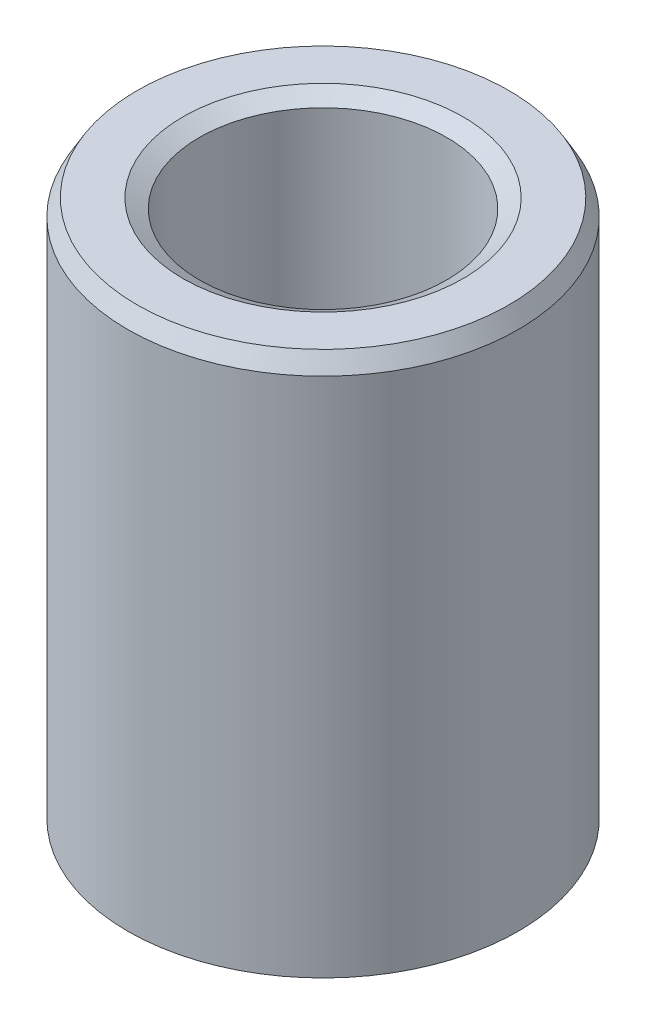
from build123d import *
from OCP.BRepFilletAPI import BRepFilletAPI_MakeChamfer

# Parameters (mm, degrees)
SKETCH1_R           = 25
BOSS_EXTRUDE1_DEPTH = 70.03656948
SKETCH2_R           = 15.821900765
CUT_EXTRUDE1_DEPTH  = 79.454579628
CHAMFER1_SIZE       = 2.111979683
CHAMFER1_SIZE2      = 1.219352039


with BuildPart() as part:
    # Sketch1 → Boss-Extrude1 (new body)
    with BuildSketch(Plane(origin=(0, 0, 0), x_dir=(1, 0, 0), z_dir=(0, 1, 0))):
        Circle(SKETCH1_R)
    extrude(amount=BOSS_EXTRUDE1_DEPTH)

    # Sketch2 → Cut-Extrude1 (cut, through all)
    with BuildSketch(Plane(origin=(0, 0, 0), x_dir=(1, 0, 0), z_dir=(0, 1, 0))):
        Circle(SKETCH2_R)
    extrude(amount=CUT_EXTRUDE1_DEPTH, mode=Mode.SUBTRACT)

    # Chamfer1: one chamfer whose edges measure the first distance from different faces: ONE call of the kernel's chamfer builder (chamfer() names one face for all edges)
    chamfer1_edges_1 = [part.edges().sort_by_distance(p)[0] for p in [
        (-15.821900765, 70.03656948, 0),
    ]]
    chamfer1_side_1 = [part.faces().sort_by_distance(p)[0] for p in [
        (-24.292893219, 70.03656948, 0),
    ]]
    chamfer1_edges_2 = [part.edges().sort_by_distance(p)[0] for p in [
        (-15.821900765, 0, 0),
    ]]
    chamfer1_side_2 = [part.faces().sort_by_distance(p)[0] for p in [
        (-15.821900765, 35.01828474, 0),
    ]]
    chamfer1_edges_3 = [part.edges().sort_by_distance(p)[0] for p in [
        (-25, 0, 0),
    ]]
    chamfer1_side_3 = [part.faces().sort_by_distance(p)[0] for p in [
        (-24.292893219, 0, 0),
    ]]
    chamfer1_edges_4 = [part.edges().sort_by_distance(p)[0] for p in [
        (-25, 70.03656948, 0),
    ]]
    chamfer1_side_4 = [part.faces().sort_by_distance(p)[0] for p in [
        (-25, 35.01828474, 0),
    ]]
    chamfer1 = BRepFilletAPI_MakeChamfer(part.part.solid().wrapped)
    for e in chamfer1_edges_1:
        chamfer1.Add(CHAMFER1_SIZE, CHAMFER1_SIZE2, e.wrapped, chamfer1_side_1[0].wrapped)  # the first distance lies on this face
    for e in chamfer1_edges_2:
        chamfer1.Add(CHAMFER1_SIZE, CHAMFER1_SIZE2, e.wrapped, chamfer1_side_2[0].wrapped)  # the first distance lies on this face
    for e in chamfer1_edges_3:
        chamfer1.Add(CHAMFER1_SIZE, CHAMFER1_SIZE2, e.wrapped, chamfer1_side_3[0].wrapped)  # the first distance lies on this face
    for e in chamfer1_edges_4:
        chamfer1.Add(CHAMFER1_SIZE, CHAMFER1_SIZE2, e.wrapped, chamfer1_side_4[0].wrapped)  # the first distance lies on this face
    add(Compound.cast(chamfer1.Shape()), mode=Mode.REPLACE)


solid = part.part
